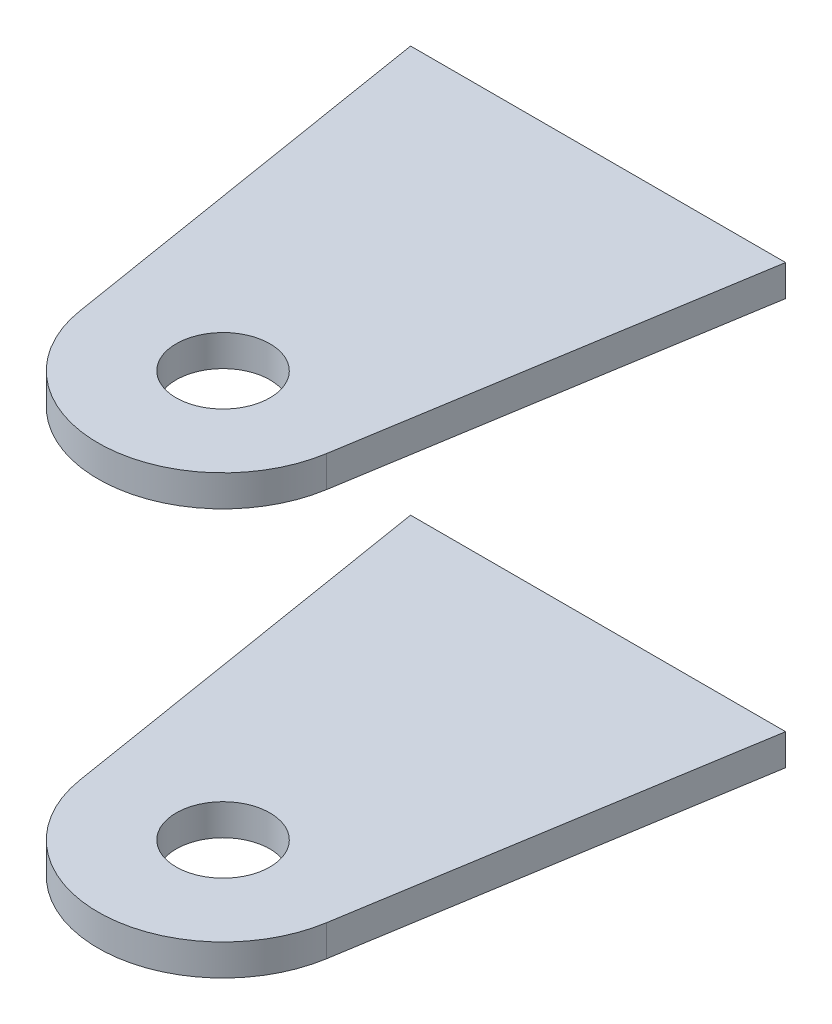
from build123d import *

# Parameters (mm, degrees)
BOSS_EXTRUDE1_START = 19.05
SKETCH2_R           = 4.7625
BOSS_EXTRUDE1_DEPTH = 3.175
BOSS_EXTRUDE2_START = -19.05
SKETCH2_3_R         = 4.7625
BOSS_EXTRUDE2_DEPTH = 3.175


with BuildPart() as part:
    # Sketch2 → Boss-Extrude1 (new body)
    with BuildSketch(Plane(origin=(0, 0, 0), x_dir=(1, 0, 0), z_dir=(0, 1, 0)).offset(BOSS_EXTRUDE1_START)):
        with BuildLine():
            ThreePointArc((-12.535957042, -2.034645188), (0, -12.7), (12.535957042, -2.034645188))
            Line((12.535957042, -2.034645188), (19.05, 38.1))
            Line((19.05, 38.1), (-19.05, 38.1))
            Line((-19.05, 38.1), (-12.535957042, -2.034645188))
        make_face()
        Circle(SKETCH2_R, mode=Mode.SUBTRACT)
    extrude(amount=BOSS_EXTRUDE1_DEPTH)


with BuildPart() as body_2:
    # Sketch2<3> → Boss-Extrude2 (new body)
    with BuildSketch(Plane(origin=(0, 0, 0), x_dir=(1, 0, 0), z_dir=(0, 1, 0)).offset(BOSS_EXTRUDE2_START)):
        with BuildLine():
            ThreePointArc((-12.535957042, -2.034645188), (0, -12.7), (12.535957042, -2.034645188))
            Line((12.535957042, -2.034645188), (19.05, 38.1))
            Line((19.05, 38.1), (-19.05, 38.1))
            Line((-19.05, 38.1), (-12.535957042, -2.034645188))
        make_face()
        Circle(SKETCH2_3_R, mode=Mode.SUBTRACT)
    extrude(amount=-BOSS_EXTRUDE2_DEPTH)


solid = Compound([part.part, body_2.part])
